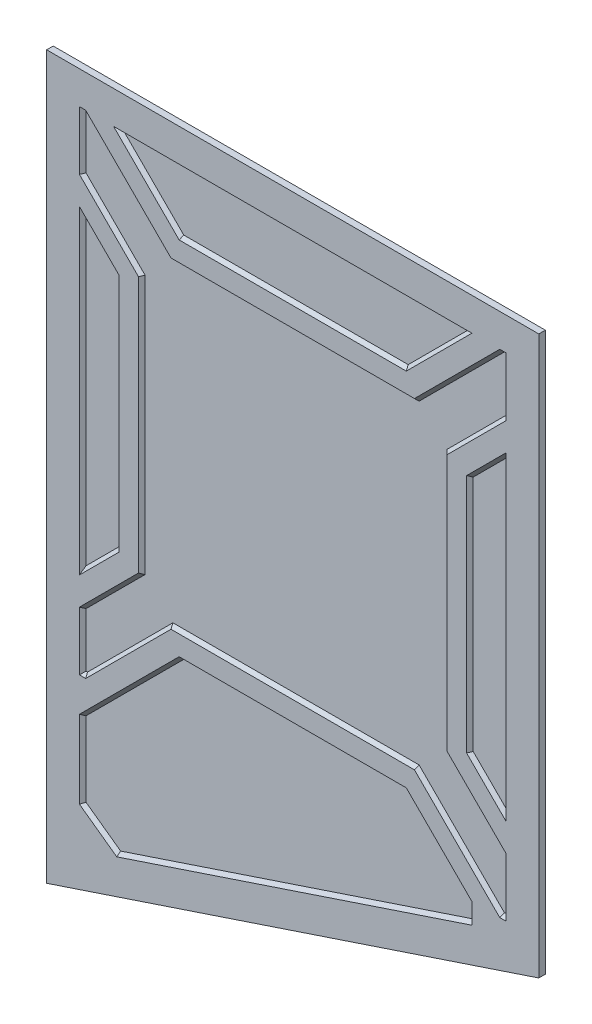
from build123d import *

# Parameters (mm, degrees)
BOSS_EXTRU_1_DEPTH      = 10
ENL_V_MAT_EXTRU_1_DEPTH = 5
CHANFREIN1_SIZE         = 5


with BuildPart() as part:
    # Esquisse1 → Boss.-Extru.1 (new body)
    with BuildSketch(Plane.XY):
        Polygon((750, 0), (0, -250), (0, 0), (0, 850), (750, 850), align=None)
    extrude(amount=BOSS_EXTRU_1_DEPTH)

    # Esquisse2 → Enlèv. mat.-Extru.1 (cut)
    with BuildSketch(Plane.XY.offset(10)):
        Polygon((110, 241.923881554), (110, 608.076118446), (50, 668.076118446), (50, 181.923881554), align=None)
        Polygon((201.923881554, 700), (548.076118446, 700), (648.076118446, 800), (101.923881554, 800), align=None)
        Polygon((50, 800), (50, 710.502525317), (140, 620.502525317), (140, 229.497474683), (50, 139.497474683), (50, 50), (59.497474683, 50), (189.497474683, 180), (560.502525317, 180), (690.502525317, 50), (700, 50), (700, 139.497474683), (610, 229.497474683), (610, 620.502525317), (700, 710.502525317), (700, 800), (690.502525317, 800), (560.502525317, 670), (189.497474683, 670), (59.497474683, 800), align=None)
        Polygon((700, 668.076118446), (700, 181.923881554), (640, 241.923881554), (640, 608.076118446), align=None)
        Polygon((648.076118446, 50), (548.076118446, 150), (201.923881554, 150), (101.923881554, 50), (50, -1.923881554), (50, -120.628705664), (106.920997883, -161.655039703), (648.076118446, 18.730000485), align=None)
    extrude(amount=-ENL_V_MAT_EXTRU_1_DEPTH, mode=Mode.SUBTRACT)

    # Chanfrein1
    chanfrein1_edges = [part.edges().sort_by_distance(p)[0] for p in [
        (50, 425, 5),
        (80, 638.076118446, 5),
        (124.497474683, 735, 5),
        (375, 670, 5),
        (140, 425, 5),
        (95, 665.502525317, 5),
        (50, 755.251262658, 5),
        (54.748737342, 800, 5),
        (375, 800, 5),
        (375, 700, 5),
        (151.923881554, 750, 5),
        (110, 425, 5),
        (80, 211.923881554, 5),
        (625.502525317, 735, 5),
        (695.251262658, 800, 5),
        (700, 755.251262658, 5),
        (655, 665.502525317, 5),
        (610, 425, 5),
        (655, 184.497474683, 5),
        (700, 94.748737342, 5),
        (695.251262658, 50, 5),
        (625.502525317, 115, 5),
        (375, 180, 5),
        (124.497474683, 115, 5),
        (54.748737342, 50, 5),
        (50, 94.748737342, 5),
        (95, 184.497474683, 5),
        (598.076118446, 750, 5),
        (700, 425, 5),
        (670, 211.923881554, 5),
        (640, 425, 5),
        (670, 638.076118446, 5),
        (375, 150, 5),
        (598.076118446, 100, 5),
        (648.076118446, 34.365000242, 5),
        (377.498558164, -71.462519609, 5),
        (78.460498942, -141.141872683, 5),
        (50, -61.276293609, 5),
        (125.961940777, 74.038059223, 5),
    ]]
    chamfer(chanfrein1_edges, length=CHANFREIN1_SIZE - 0.0001)  # a hair under: the kernel refuses the full size


solid = part.part
